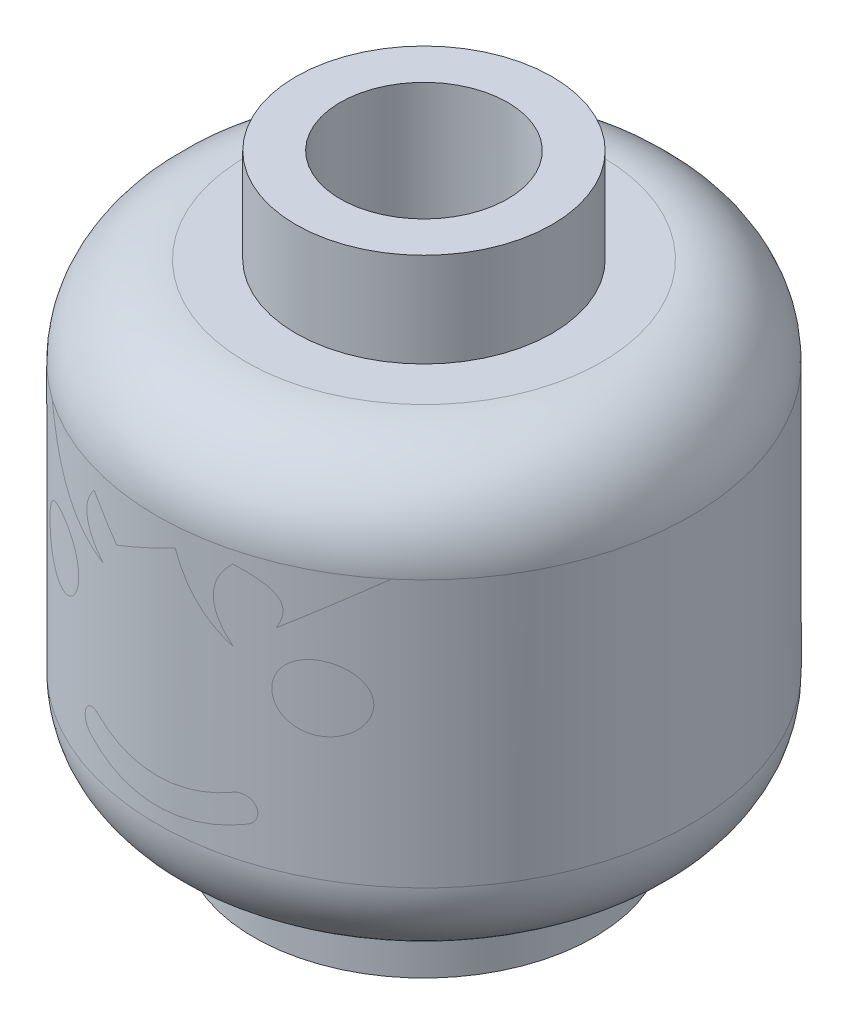
from build123d import *
from build123d.topology import SkipClean

# Parameters (mm, degrees)
CUT_EXTRUDE1_DEPTH = 12.848206658
CIRPATTERN1_COUNT  = 3


with BuildPart() as part:
    # Sketch1 → Revolve1 (revolve)
    with BuildSketch(Plane.XY):
        with BuildLine():
            Line((0, 9.4), (1.6, 9.4))
            Line((1.6, 9.4), (1.6, 11.4))
            Line((1.6, 11.4), (2.45, 11.4))
            Line((2.45, 11.4), (2.45, 9.6))
            Line((2.45, 9.6), (3.4, 9.6))
            ThreePointArc((3.4, 9.6), (4.602081528, 9.102081528), (5.1, 7.9))
            Line((5.1, 7.9), (5.1, 2.8))
            ThreePointArc((5.1, 2.8), (4.602081528, 1.597918472), (3.4, 1.1))
            Line((3.4, 1.1), (3.25, 1.1))
            Line((3.25, 1.1), (3.25, 0))
            Line((3.25, 0), (2.45, 0))
            Line((2.45, 0), (2.45, 8.5))
            Line((2.45, 8.5), (0, 8.5))
            Line((0, 8.5), (0, 9.4))
        make_face()
    revolve(axis=Axis((0, 0, 0), (0, 1, 0)))

    # Sketch3 → Cut-Extrude1 (cut, through all)
    with SkipClean():  # the faces are left unmerged after this step: merging them gives an invalid solid
        with BuildSketch(Plane(origin=(0, 9.4, 0), x_dir=(1, 0, 0), z_dir=(0, 1, 0))):
            with BuildLine():
                Line((-0.42, 0.242487113), (-1.547048989, -0.408214924))
                ThreePointArc((-1.547048989, -0.408214924), (-1.385640646, 0.8), (-0.42, 1.543891188))
                Line((-0.42, 1.543891188), (-0.42, 0.242487113))
            make_face()
        cut_extrude1 = extrude(amount=-CUT_EXTRUDE1_DEPTH, mode=Mode.SUBTRACT)

    # CirPattern1: Cut-Extrude1 ×3 about axis
    with SkipClean():  # the faces are left unmerged after this step: merging them gives an invalid solid
        cirpattern1_axis = Axis((0, 0, 0), (0, -1, 0))
        for i in range(1, CIRPATTERN1_COUNT):
            add(cut_extrude1.rotate(cirpattern1_axis, i * 360 / CIRPATTERN1_COUNT), mode=Mode.SUBTRACT)


solid = part.part
